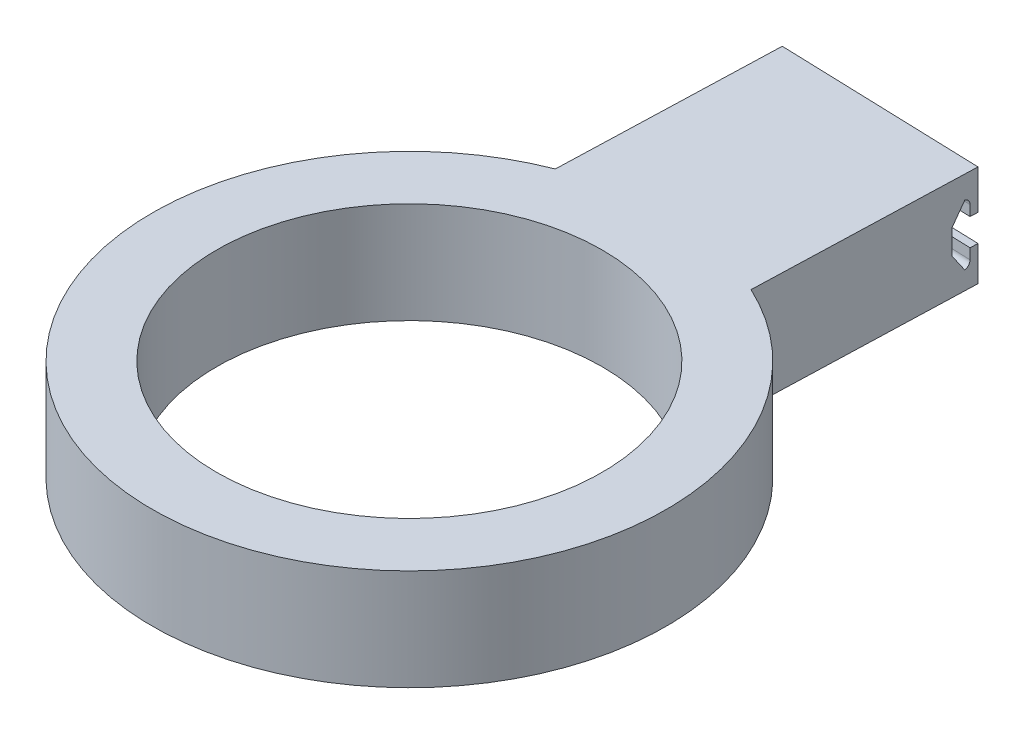
from build123d import *

# Parameters (mm, degrees)
SKETCH1_R               = 50.8
SKETCH1_R_2             = 38.1
BOSS_EXTRUDE1_DEPTH     = 20
BOSS_EXTRUDE2_START     = -20
BOSS_EXTRUDE2_DEPTH     = 20
CUT_EXTRUDE1_DEPTH      = 118.349403873
CUT_EXTRUDE1_DEPTH_BACK = 118.349403873
FILLET1_R               = 1.27


with BuildPart() as part:
    # Sketch1 → Boss-Extrude1 (new body)
    with BuildSketch(Plane(origin=(0, 0, 0), x_dir=(1, 0, 0), z_dir=(0, 1, 0))):
        with Locations(Location((0, 0, 0), (0, 0, 270))):
            Circle(SKETCH1_R)
        with Locations(Location((0, 0, 0), (0, 0, 270))):
            Circle(SKETCH1_R_2, mode=Mode.SUBTRACT)
    extrude(amount=BOSS_EXTRUDE1_DEPTH)

    # Sketch2 → Boss-Extrude2 (add)
    with BuildSketch(Plane(origin=(0, 20, 0), x_dir=(1, 0, 0), z_dir=(0, 1, 0)).offset(BOSS_EXTRUDE2_START)):
        with BuildLine():
            ThreePointArc((9.793574848, 49.847024903), (15.777570545, 48.287765197), (21.527776819, 46.012985398))
            Line((21.527776819, 46.012985398), (21.640596186, 49.459185087))
            Line((21.640596186, 49.459185087), (9.793574848, 49.847024903))
        make_face()
        with BuildLine():
            Line((-18.147499758, 57.241535713), (-18.359403814, 50.768678182))
            Line((-18.359403814, 50.768678182), (-6.512382476, 50.380838366))
            ThreePointArc((-6.512382476, 50.380838366), (1.662165771, 50.772799853), (9.793574848, 49.847024903))
            Line((9.793574848, 49.847024903), (21.640596186, 49.459185087))
            Line((21.640596186, 49.459185087), (21.852500242, 55.932042618))
            Line((21.852500242, 55.932042618), (-18.147499758, 57.241535713))
        make_face()
        with BuildLine():
            Line((-18.359403814, 50.768678182), (-18.472223181, 47.322478493))
            ThreePointArc((-18.472223181, 47.322478493), (-12.585548111, 49.216297898), (-6.512382476, 50.380838366))
            Line((-6.512382476, 50.380838366), (-18.359403814, 50.768678182))
        make_face()
        Polygon((-17.049910719, 90.768678182), (-18.147499758, 57.241535713), (21.852500242, 55.932042618), (22.950089281, 89.459185087), align=None)
    extrude(amount=BOSS_EXTRUDE2_DEPTH)

    # Sketch4 → Cut-Extrude1 (cut, two sides: drawn at the far end of the back side and taken through both)
    with BuildSketch(Plane(origin=(20, 0, 0.654746548), x_dir=(0.03271979863396448, 0, -0.9994645640428443), z_dir=(0.9994645640428443, 0, 0.03271979863396448)).offset(-CUT_EXTRUDE1_DEPTH_BACK)):
        Polygon((90.162207723, 12.222487003), (88.638207723, 12.222487003), (88.638207723, 15.524487003), (87.622207723, 15.524487003), (85.172720429, 11.968487003), (85.172720429, 7.142487003), (87.622207723, 3.586487003), (88.638207723, 3.586487003), (88.638207723, 6.888487003), (90.162207723, 6.888487003), align=None)
    extrude(amount=CUT_EXTRUDE1_DEPTH + CUT_EXTRUDE1_DEPTH_BACK, mode=Mode.SUBTRACT)

    # Fillet1
    # the kernel refuses this fillet: 1.27 mm, written as the material it adds along each edge
    with BuildSketch(Plane(origin=(-17.099775692, 3.586487003, -89.245494187), x_dir=(-0.032719798633964424, 1.5621799566964636e-12, 0.9994645640428443), z_dir=(0.9994645640428443, 0, 0.03271979863396443))) as fillet1_piece_1:
        with BuildLine():
            CenterArc((1.27, -1.244340789), FILLET1_R, 101.536959033, 78.463040967)
            Line((0, -1.244340789), (-0.0254, -1.244340789))
            Line((-0.0254, -1.244340789), (-0.0254, 0))
            Line((-0.0254, 0), (0, 0.0254))
            ThreePointArc((0, 0.0254), (0.508, 0.0254), (1.01092, 0.024886816))
            Line((1.01092, 0.024886816), (1.016, 0))
        make_face()
    extrude(amount=40.021428912)
    with BuildSketch(Plane(origin=(-17.099775692, 15.524487003, -89.245494187), x_dir=(0, -1, 0), z_dir=(0.9994645640428443, 0, 0.03271979863396443))) as fillet1_piece_2:
        with BuildLine():
            CenterArc((1.244340789, -1.27), FILLET1_R, 90, 78.463040967)
            Line((0, -1.016), (-0.024886816, -1.01092))
            ThreePointArc((-0.024886816, -1.01092), (-0.0254, -0.508), (-0.0254, 0))
            Line((-0.0254, 0), (0, 0.0254))
            Line((0, 0.0254), (1.244340789, 0.0254))
            Line((1.244340789, 0.0254), (1.244340789, 0))
        make_face()
    extrude(amount=40.021428912)


solid = part.part
